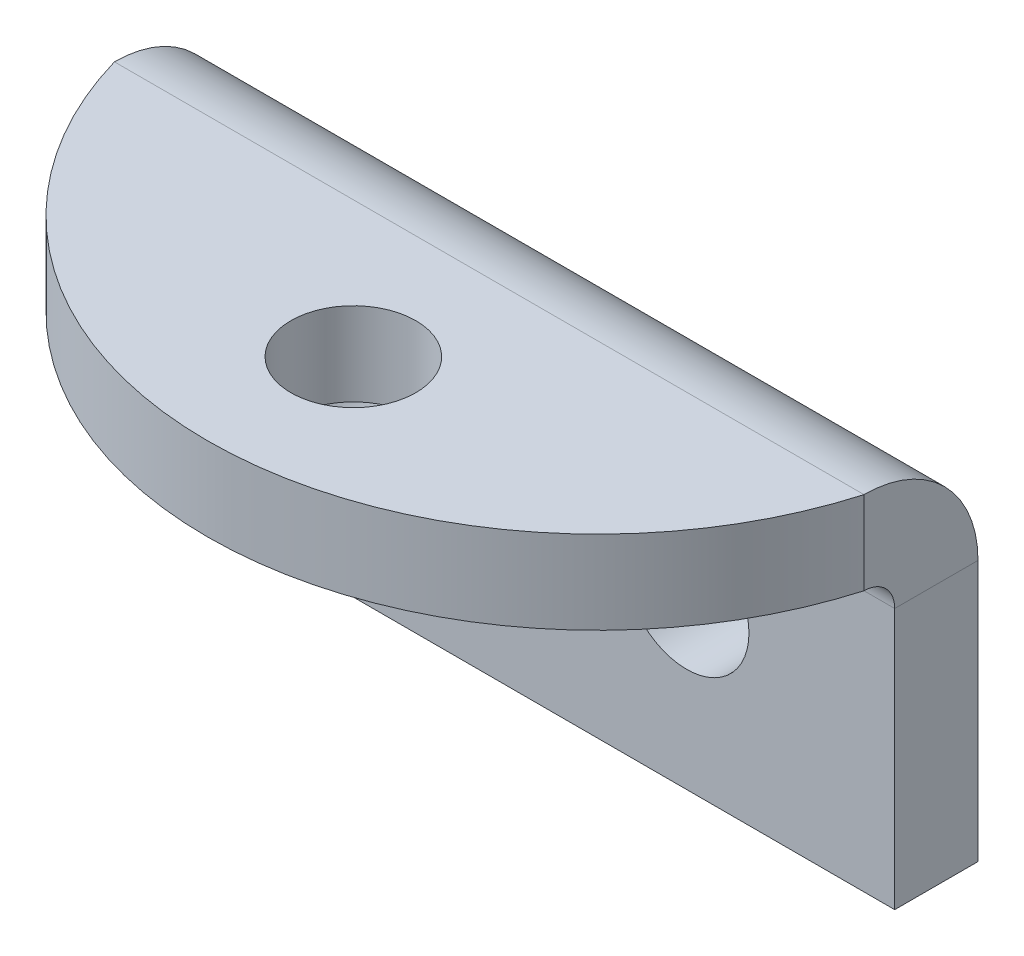
from build123d import *

# Parameters (mm, degrees)
SKETCH_1_W                       = 18
SKETCH_1_H                       = 9
SKETCH_1_R                       = 1.5
SM_BASE_FLANGE_1_DEPTH           = 2
SM_EDGE_FLANGE_1_STRIP_W         = 9.4732
SM_EDGE_FLANGE_1_STRIP_H         = 2
SM_EDGE_FLANGE_1_STRIP_CUT_DEPTH = 18
SM_EDGE_FLANGE_1_DEPTH           = 18
SKETCH_9_R                       = 1.5
CUT_EXTRUDE_1_DEPTH              = 10


# Sheet-metal steps are written as plain solids
with BuildPart() as part:
    # Sketch 1 → 基体-法兰1 (new body)
    with BuildSketch(Plane.XY):
        with Locations((9, -4.5)):
            Rectangle(SKETCH_1_W, SKETCH_1_H)
        with Locations((5, -5)):
            Circle(SKETCH_1_R, mode=Mode.SUBTRACT)
        with Locations((13, -5)):
            Circle(SKETCH_1_R, mode=Mode.SUBTRACT)
    extrude(amount=-SM_BASE_FLANGE_1_DEPTH)

    # 边线-法兰1 strip (across the edge) → 边线-法兰1 strip cut (cut)
    with BuildSketch(Plane(origin=(18, 0, 0), x_dir=(0, -1, 0), z_dir=(-1, 0, 0))):
        with Locations((-2, -1)):
            Rectangle(SM_EDGE_FLANGE_1_STRIP_W, SM_EDGE_FLANGE_1_STRIP_H)
    extrude(amount=SM_EDGE_FLANGE_1_STRIP_CUT_DEPTH, mode=Mode.SUBTRACT)

    # 边线-法兰1 section (across the edge) → 边线-法兰1 (add)
    with BuildSketch(Plane(origin=(18, 0, 0), x_dir=(0, -1, 0), z_dir=(-1, 0, 0))):
        with BuildLine():
            Line((0, 0.7366), (0, 18))
            Line((0, 18), (2, 18))
            Line((2, 18), (2, 0.7366))
            ThreePointArc((2, 0.7366), (2.215745145, 0.215745145), (2.7366, 0))
            Line((2.7366, 0), (2.7366, -2))
            ThreePointArc((2.7366, -2), (0.801531583, -1.198468417), (0, 0.7366))
        make_face()
    extrude(amount=SM_EDGE_FLANGE_1_DEPTH)

    # 草图9 → 切除-拉伸1 (cut)
    with BuildSketch(Plane.XZ.offset(2)):
        with Locations(Location((9, 4, 0), (0, 0, 270))):
            Circle(SKETCH_9_R)
        with BuildLine():
            Line((18, 0.7366), (18, 18))
            Line((18, 18), (0, 18))
            Line((0, 18), (0, 0.7366))
            ThreePointArc((0, 0.7366), (9, 7.5), (18, 0.7366))
        make_face()
    extrude(amount=-CUT_EXTRUDE_1_DEPTH, mode=Mode.SUBTRACT)


solid = part.part
